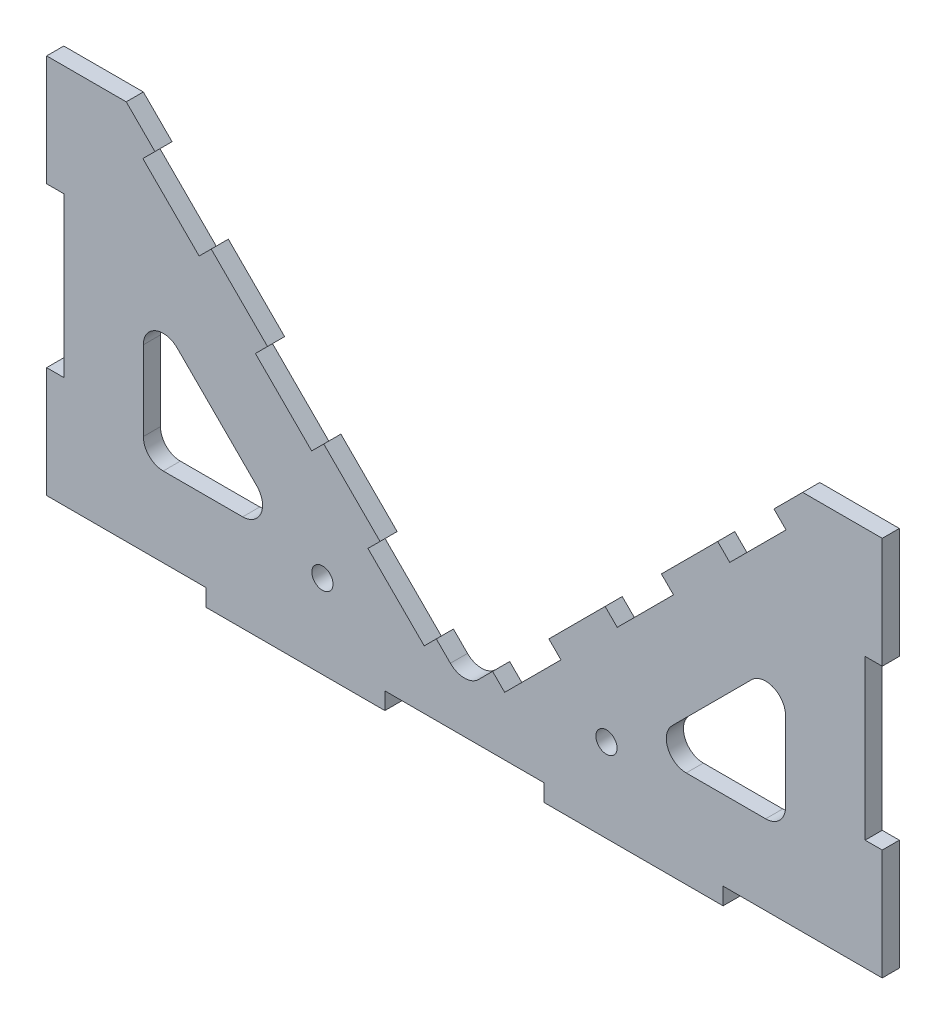
from build123d import *

# Parameters (mm, degrees)
BOSS_EXTRUDE1_DEPTH     = 2.7305
CUT_EXTRUDE1_DEPTH      = 178.79882071
CAVITY1_START           = -133.35
CAVITY1_OUTLINE_W       = 50.8
CAVITY1_OUTLINE_H       = 5.461
CAVITY1_DEPTH           = 5.461
CAVITY1_START_2         = 127.889
CAVITY1_2_OUTLINE_W     = 50.8
CAVITY1_2_OUTLINE_H     = 5.461
CAVITY1_2_DEPTH         = 5.461
FILLET1_R               = 6.35
SKETCH3_W               = 5.461
SKETCH3_H               = 50.8
CUT_EXTRUDE2_DEPTH      = 178.79882071
FILLET2_R               = 6.35
F_1_4_CLEARANCE_HOLE1_D = 6.7564


# Read off the part's stored shape, not the designer's step: Cavity1
with BuildPart() as part:
    # Sketch1 → Boss-Extrude1 (new, symmetric)
    with BuildSketch(Plane.XY):
        Polygon((133.35, -4.064), (133.35, 117.475), (107.95, 117.475), (0, 9.525), (-107.95, 117.475), (-133.35, 117.475), (-133.35, -4.064), (-82.55, -4.064), (-82.55, -9.525), (-25.4, -9.525), (-25.4, -4.064), (25.4, -4.064), (25.4, -9.525), (82.55, -9.525), (82.55, -4.064), align=None)
    extrude(amount=BOSS_EXTRUDE1_DEPTH, both=True)

    # Sketch2 → Cut-Extrude1 (cut, through all)
    with BuildSketch(Plane.XY.offset(2.7305)):
        Polygon((-8.980256121, 18.505256121), (-12.841766253, 14.643745989), (-30.802278495, 32.604258231), (-26.940768363, 36.465768363), align=None)
        Polygon((-62.861792847, 72.386792847), (-66.72330298, 68.525282715), (-48.762790737, 50.564770473), (-44.901280605, 54.426280605), align=None)
        Polygon((-98.782817332, 108.307817332), (-102.644327464, 104.4463072), (-84.683815222, 86.485794958), (-80.82230509, 90.34730509), align=None)
        Polygon((80.82230509, 90.34730509), (98.782817332, 108.307817332), (102.644327464, 104.4463072), (84.683815222, 86.485794958), align=None)
        Polygon((44.901280605, 54.426280605), (62.861792847, 72.386792847), (66.72330298, 68.525282715), (48.762790737, 50.564770473), align=None)
        Polygon((26.940768363, 36.465768363), (30.802278495, 32.604258231), (12.841766253, 14.643745989), (8.980256121, 18.505256121), align=None)
    extrude(amount=-CUT_EXTRUDE1_DEPTH, mode=Mode.SUBTRACT)

    # Cavity1 outline → Cavity1 (cut)
    with BuildSketch(Plane.YZ.offset(CAVITY1_START)):
        with Locations((56.7055, 0)):
            Rectangle(CAVITY1_OUTLINE_W, CAVITY1_OUTLINE_H)
    extrude(amount=CAVITY1_DEPTH, mode=Mode.SUBTRACT)

    # Cavity1 2 outline → Cavity1 2 (cut)
    with BuildSketch(Plane.YZ.offset(CAVITY1_START_2)):
        with Locations((56.7055, 0)):
            Rectangle(CAVITY1_2_OUTLINE_W, CAVITY1_2_OUTLINE_H)
    extrude(amount=CAVITY1_2_DEPTH, mode=Mode.SUBTRACT)

    # Fillet1
    fillet1_edges = [part.edges().sort_by_distance(p)[0] for p in [
        (0, 9.525, 0),
    ]]
    fillet(fillet1_edges, radius=FILLET1_R)

    # Sketch3 → Cut-Extrude2 (cut, through all)
    with BuildSketch(Plane.XY.offset(2.7305)):
        with Locations((-130.6195, 56.7055)):
            Rectangle(SKETCH3_W, SKETCH3_H)
        Polygon((-102.489, 68.369955252), (-55.455044748, 21.336), (-102.489, 21.336), (-102.489, 31.3055), align=None)
    cut_extrude2 = extrude(amount=-CUT_EXTRUDE2_DEPTH, mode=Mode.SUBTRACT)

    # Mirror1: Cut-Extrude2 across plane
    add(cut_extrude2.mirror(Plane(origin=(0, 0, 0), x_dir=(0, 0, 1), z_dir=(1, 0, 0))), mode=Mode.SUBTRACT)

    # Fillet2
    fillet2_edges = [part.edges().sort_by_distance(p)[0] for p in [
        (-55.455044748, 21.336, 0),
        (-102.489, 21.336, 0),
        (-102.489, 68.369955252, 0),
        (102.489, 21.336, 0),
        (55.455044748, 21.336, 0),
        (102.489, 68.369955252, 0),
    ]]
    fillet(fillet2_edges, radius=FILLET2_R)

    # 1/4 Clearance Hole1 (through all)
    with Locations(Plane.XY.offset(2.7305)):
        with Locations((-45.327694765, 17.141114286)):
            f_1_4_clearance_hole1 = Hole(F_1_4_CLEARANCE_HOLE1_D / 2)

    # Mirror2: 1/4 Clearance Hole1 across plane
    add(f_1_4_clearance_hole1.mirror(Plane(origin=(0, 0, 0), x_dir=(0, 0, 1), z_dir=(1, 0, 0))), mode=Mode.SUBTRACT)


solid = part.part
